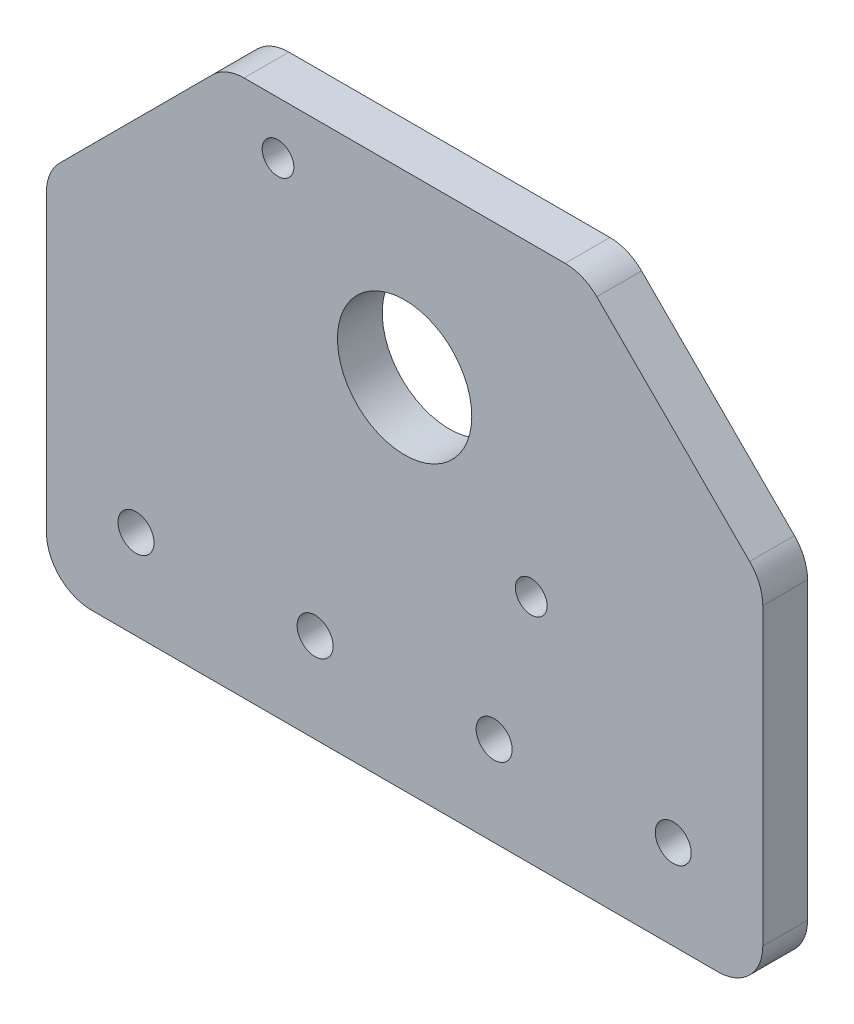
from build123d import *

# Parameters (mm, degrees)
SKETCH1_W              = 101.6
SKETCH1_H              = 76.2
SKETCH1_R              = 9.525
BOSS_EXTRUDE1_DEPTH    = 3.175
F_8_CLEARANCE_HOLE1_D  = 4.4958
CHAMFER1_SIZE          = 25.4
F_10_CLEARANCE_HOLE2_D = 5.1054
FILLET1_R              = 6.35


with BuildPart() as part:
    # Sketch1 → Boss-Extrude1 (new, symmetric)
    with BuildSketch(Plane.XY):
        with Locations((0, -12.7)):
            Rectangle(SKETCH1_W, SKETCH1_H)
        Circle(SKETCH1_R, mode=Mode.SUBTRACT)
    extrude(amount=BOSS_EXTRUDE1_DEPTH, both=True)

    # #8 Clearance Hole1 (through all)
    with Locations(Plane.XY.offset(3.175)):
        with Locations((-17.960512242, 17.960512242), (17.960512242, -17.960512242)):
            Hole(F_8_CLEARANCE_HOLE1_D / 2)

    # Chamfer1
    chamfer1_edges = [part.edges().sort_by_distance(p)[0] for p in [
        (50.8, 25.4, 0),
        (-50.8, 25.4, 0),
    ]]
    chamfer(chamfer1_edges, length=CHAMFER1_SIZE)

    # #10 Clearance Hole2 (through all)
    with Locations(Plane.XY.offset(3.175)):
        with Locations((-38.1, -38.1), (-12.7, -38.1), (12.7, -38.1), (38.1, -38.1)):
            Hole(F_10_CLEARANCE_HOLE2_D / 2)

    # Fillet1
    fillet1_edges = [part.edges().sort_by_distance(p)[0] for p in [
        (50.8, -50.8, 0),
        (-50.8, -50.8, 0),
        (-50.8, 0, 0),
        (-25.4, 25.4, 0),
        (50.8, 0, 0),
        (25.4, 25.4, 0),
    ]]
    fillet(fillet1_edges, radius=FILLET1_R)


solid = part.part
